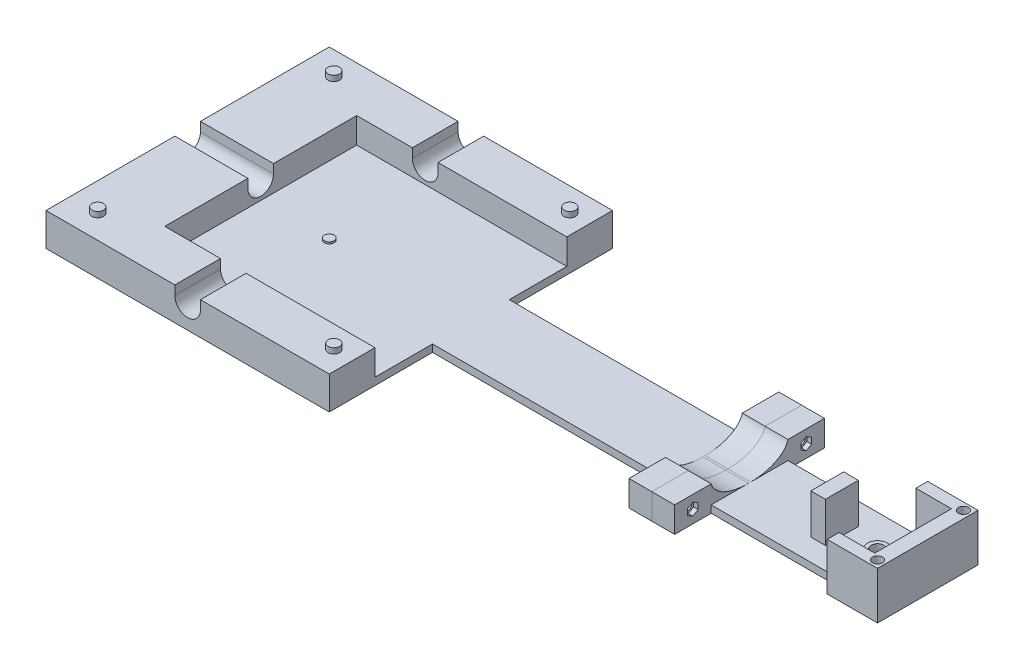
from build123d import *

# Parameters (mm, degrees)
SKETCH1_W                      = 8
SKETCH1_H                      = 18
SKETCH1_R                      = 3.425
BOSS_EXTRUDE1_DEPTH            = 4
SKETCH1_3_R                    = 2.75
SKETCH1_3_W                    = 8
SKETCH1_3_H                    = 18
BOSS_EXTRUDE2_DEPTH            = 25.9
SKETCH4_R                      = 5.425
SKETCH4_R_2                    = 3.425
BOSS_EXTRUDE5_DEPTH            = 3.7
BOSS_EXTRUDE6_DEPTH            = 14
SKETCH6_R                      = 3.15
SKETCH6_R_2                    = 3.175
BOSS_EXTRUDE7_DEPTH            = 3
SKETCH7_R                      = 2.65
BOSS_EXTRUDE8_DEPTH            = 1
CUT_EXTRUDE1_DEPTH             = 40
CIRPATTERN1_COUNT              = 4
SKETCH12_W                     = 12.5
SKETCH12_H                     = 20
BOSS_EXTRUDE9_DEPTH            = 4
SKETCH12_3_W                   = 12.5
SKETCH12_3_H                   = 20
BOSS_EXTRUDE10_DEPTH           = 10
FILLET3_START                  = -95
FILLET3_DEPTH                  = 25
CUT_EXTRUDE2_DEPTH             = 2.5
CBORE_FOR_M3_SHCS1_D           = 3.6
CBORE_FOR_M3_SHCS1_DEPTH       = 22.5
CBORE_FOR_M3_SHCS1_CBORE_D     = 6.5
CBORE_FOR_M3_SHCS1_CBORE_DEPTH = 3


with BuildPart() as part:
    # Sketch1 → Boss-Extrude1 (new body)
    with BuildSketch(Plane(origin=(0, 0, 0), x_dir=(1, 0, 0), z_dir=(0, 1, 0))):
        Polygon((-222.5, -21), (0, -21), (19.5, -21), (19.5, 21), (0, 21), (-222.5, 21), (-222.5, 77.5), (-377.5, 77.5), (-377.5, -77.5), (-222.5, -77.5), align=None)
        with Locations((-23.5, 0)):
            Rectangle(SKETCH1_W, SKETCH1_H, mode=Mode.SUBTRACT)
        with Locations(Location((0, 0, 0), (0, 0, 270))):
            Circle(SKETCH1_R, mode=Mode.SUBTRACT)
    extrude(amount=BOSS_EXTRUDE1_DEPTH)

    # Sketch1<3> → Boss-Extrude2 (add)
    # profile 1 of 2: a face of its own
    with BuildSketch(Plane(origin=(0, 0, 0), x_dir=(1, 0, 0), z_dir=(0, 1, 0))):
        Polygon((27.5, -27.5), (27.5, 27.5), (0, 27.5), (0, 21), (19.5, 21), (19.5, -21), (0, -21), (0, -27.5), align=None)
        with Locations(Location((23.5, 23.5, 0), (0, 0, 90))):
            Circle(SKETCH1_3_R, mode=Mode.SUBTRACT)
        with Locations(Location((23.5, -23.5, 0), (0, 0, 90))):
            Circle(SKETCH1_3_R, mode=Mode.SUBTRACT)
    # profile 2 of 2: a face of its own
    with BuildSketch(Plane(origin=(0, 0, 0), x_dir=(1, 0, 0), z_dir=(0, 1, 0))):
        with Locations((-23.5, 0)):
            Rectangle(SKETCH1_3_W, SKETCH1_3_H)
    extrude(amount=BOSS_EXTRUDE2_DEPTH)

    # Sketch4 → Boss-Extrude5 (add)
    with BuildSketch(Plane(origin=(0, 4, 0), x_dir=(1, 0, 0), z_dir=(0, 1, 0))):
        with Locations(Location((0, 0, 0), (0, 0, 270))):
            Circle(SKETCH4_R)
        with Locations(Location((0, 0, 0), (0, 0, 270))):
            Circle(SKETCH4_R_2, mode=Mode.SUBTRACT)
    extrude(amount=BOSS_EXTRUDE5_DEPTH)

    # Sketch5 → Boss-Extrude6 (add)
    with BuildSketch(Plane(origin=(0, 4, 0), x_dir=(1, 0, 0), z_dir=(0, 1, 0))):
        Polygon((-377.5, 77.5), (-222.5, 77.5), (-222.5, 52.5), (-337.5, 52.5), (-337.5, -52.5), (-222.5, -52.5), (-222.5, -77.5), (-377.5, -77.5), align=None)
    extrude(amount=BOSS_EXTRUDE6_DEPTH)

    # Sketch6 → Boss-Extrude7 (add)
    with BuildSketch(Plane(origin=(0, 18, 0), x_dir=(1, 0, 0), z_dir=(0, 1, 0))):
        with Locations(Location((-232.925, 64.575, 0), (0, 0, 90))):
            Circle(SKETCH6_R)
        with Locations(Location((-232.925, -64.575, 0), (0, 0, 90))):
            Circle(SKETCH6_R)
        with Locations(Location((-362.075, -64.575, 0), (0, 0, 90))):
            Circle(SKETCH6_R)
        with Locations(Location((-362.075, 64.575, 0), (0, 0, 90))):
            Circle(SKETCH6_R_2)
    extrude(amount=BOSS_EXTRUDE7_DEPTH)

    # Sketch7 → Boss-Extrude8 (add)
    with BuildSketch(Plane(origin=(0, 4, 0), x_dir=(1, 0, 0), z_dir=(0, 1, 0))):
        with Locations(Location((-300, 0, 0), (0, 0, 270))):
            Circle(SKETCH7_R)
    extrude(amount=BOSS_EXTRUDE8_DEPTH)

    # Sketch9 → Cut-Extrude1 (cut)
    with BuildSketch(Plane.XY.offset(77.5)):
        with BuildLine():
            Line((-293, 18), (-307, 18))
            Line((-307, 18), (-307, 13))
            ThreePointArc((-307, 13), (-300, 6), (-293, 13))
            Line((-293, 13), (-293, 18))
        make_face()
    cut_extrude1 = extrude(amount=-CUT_EXTRUDE1_DEPTH, mode=Mode.SUBTRACT)

    # CirPattern1: Cut-Extrude1 ×4 about axis
    cirpattern1_axis = Axis((-300, 5, 0), (0, -1, 0))
    for i in range(1, CIRPATTERN1_COUNT):
        add(cut_extrude1.rotate(cirpattern1_axis, i * 360 / CIRPATTERN1_COUNT), mode=Mode.SUBTRACT)

    # Sketch12 → Boss-Extrude9 (add)
    with BuildSketch(Plane(origin=(0, 4, 0), x_dir=(1, 0, 0), z_dir=(0, 1, 0))):
        with Locations((-76.25, -31)):
            Rectangle(SKETCH12_W, SKETCH12_H)
        with Locations((-88.75, -31)):
            Rectangle(SKETCH12_W, SKETCH12_H)
        with Locations((-76.25, 31)):
            Rectangle(SKETCH12_W, SKETCH12_H)
        with Locations((-88.75, 31)):
            Rectangle(SKETCH12_W, SKETCH12_H)
    extrude(amount=-BOSS_EXTRUDE9_DEPTH)

    # Sketch12<3> → Boss-Extrude10 (add)
    with BuildSketch(Plane(origin=(0, 4, 0), x_dir=(1, 0, 0), z_dir=(0, 1, 0))):
        with Locations((-88.75, 31)):
            Rectangle(SKETCH12_3_W, SKETCH12_3_H)
        with Locations((-76.25, 31)):
            Rectangle(SKETCH12_3_W, SKETCH12_3_H)
        with Locations((-88.75, -31)):
            Rectangle(SKETCH12_3_W, SKETCH12_3_H)
        with Locations((-76.25, -31)):
            Rectangle(SKETCH12_3_W, SKETCH12_3_H)
    extrude(amount=BOSS_EXTRUDE10_DEPTH)

    # Fillet3: read off the stored shape, not the designer's step
    # Fillet3 outline → Fillet3 (add)
    with BuildSketch(Plane.YZ.offset(FILLET3_START)):
        with BuildLine():
            add(Edge.make_bspline(
                [(14, -21), (4, -18.548548311), (4, -0.603921946)],
                knots=[0, 0, 0, 1, 1, 1], degree=2, weights=[1, 0.786795792, 1]))
            Line((4, -0.603921946), (4, -21))
            Line((4, -21), (14, -21))
        make_face()
        with BuildLine():
            add(Edge.make_bspline(
                [(14, 21), (4, 18.548548311), (4, 0.603921946)],
                knots=[0, 0, 0, 1, 1, 1], degree=2, weights=[1, 0.786795792, 1]))
            Line((14, 21), (4, 21))
            Line((4, 21), (4, 0.603921946))
        make_face()
    extrude(amount=FILLET3_DEPTH)

    # Sketch14 → Cut-Extrude2 (cut)
    with BuildSketch(Plane(origin=(-70, 0, 0), x_dir=(0, 0, -1), z_dir=(1, 0, 0))):
        Polygon((-31, 3.680235952), (-28.125, 5.340117976), (-28.125, 8.659882024), (-31, 10.319764048), (-33.875, 8.659882024), (-33.875, 5.340117976), align=None)
        Polygon((33.875, 5.340117976), (31, 3.680235952), (28.125, 5.340117976), (28.125, 8.659882024), (31, 10.319764048), (33.875, 8.659882024), align=None)
    extrude(amount=-CUT_EXTRUDE2_DEPTH, mode=Mode.SUBTRACT)

    # CBORE for M3 SHCS1
    with Locations(Plane.ZY.offset(95)):
        with Locations((-31, 7), (31, 7)):
            CounterBoreHole(CBORE_FOR_M3_SHCS1_D / 2, CBORE_FOR_M3_SHCS1_CBORE_D / 2, CBORE_FOR_M3_SHCS1_CBORE_DEPTH, depth=CBORE_FOR_M3_SHCS1_DEPTH)


with BuildPart() as body_2:
    # Split1: the piece on the far side of the plane
    add(part.part)
    split(bisect_by=Plane(origin=(-82.5, 0, 0), x_dir=(0, 0, -1), z_dir=(-1, 0, 0)), keep=Keep.BOTTOM)


with BuildPart() as part_1:
    add(part.part)

    # Split1
    split(bisect_by=Plane(origin=(-82.5, 0, 0), x_dir=(0, 0, -1), z_dir=(-1, 0, 0)), keep=Keep.TOP)


solid = Compound([body_2.part, part_1.part])
